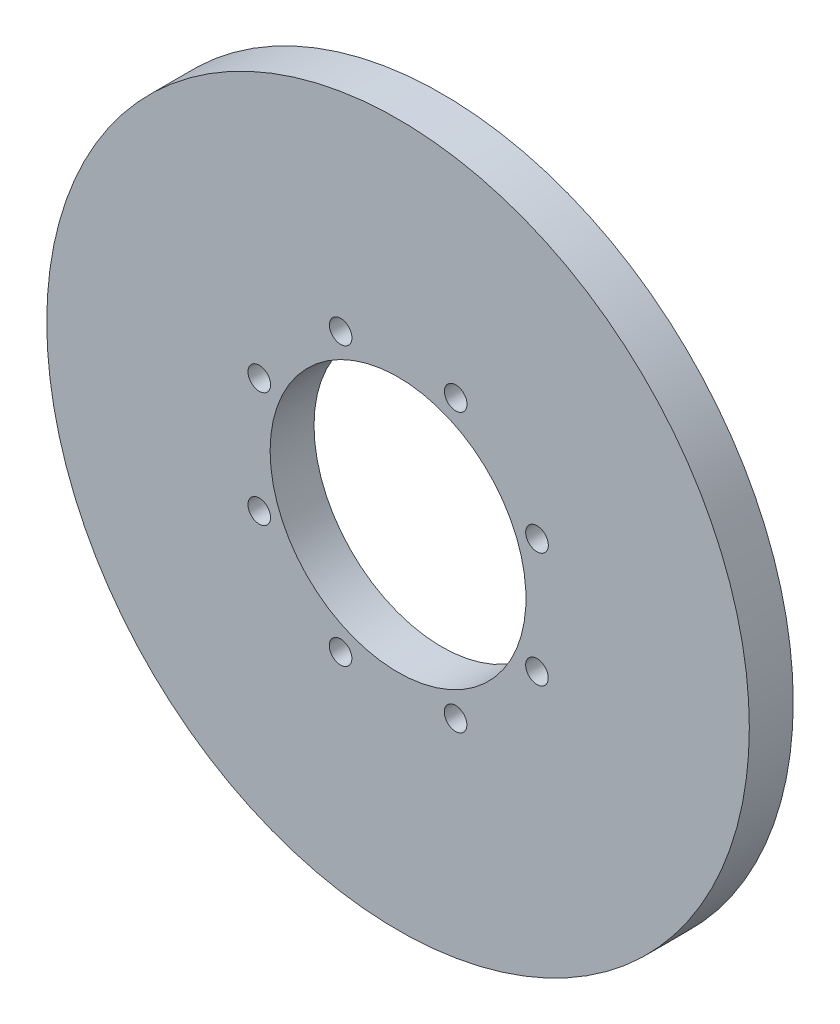
from build123d import *

# Parameters (mm, degrees)
SKETCH1_R                  = 152.4
BOSS_EXTRUDE1_DEPTH        = 19.05
SKETCH5_R                  = 55
CUT_EXTRUDE1_DEPTH         = 217.366407975
F_3_8_CLEARANCE_HOLE1_D    = 9.8044
NIPPLE_SOCKET_CLEARANCE_BY = 0.5


with BuildPart() as part:
    # Sketch1 → Boss-Extrude1 (new body)
    with BuildSketch(Plane.XY):
        Circle(SKETCH1_R)
    extrude(amount=BOSS_EXTRUDE1_DEPTH)

    # Sketch5 → Cut-Extrude1 (cut, through all)
    with BuildSketch(Plane(origin=(0, 0, 0), x_dir=(-1, 0, 0), z_dir=(0, 0, -1))):
        Circle(SKETCH5_R)
    extrude(amount=-CUT_EXTRUDE1_DEPTH, mode=Mode.SUBTRACT)

    # 3/8 Clearance Hole1 (through all)
    with Locations(Plane.XY.offset(19.05)):
        with Locations((24.960139625, -60.310047544), (60.262270814, -25.040214665), (60.285109168, 24.861699689), (25.015276288, 60.163830878), (-24.886638066, 60.186669232), (-60.188769255, 24.916836352), (-60.211607608, -24.985078002), (-24.941774729, -60.287209191)):
            Hole(F_3_8_CLEARANCE_HOLE1_D / 2)

    # nipple-socket-clearance: a curved face moved inward by 0.5
    add(Solid.thicken(part.faces().sort_by_distance((55, 0, 9.525))[0], -NIPPLE_SOCKET_CLEARANCE_BY), mode=Mode.SUBTRACT)


solid = part.part
